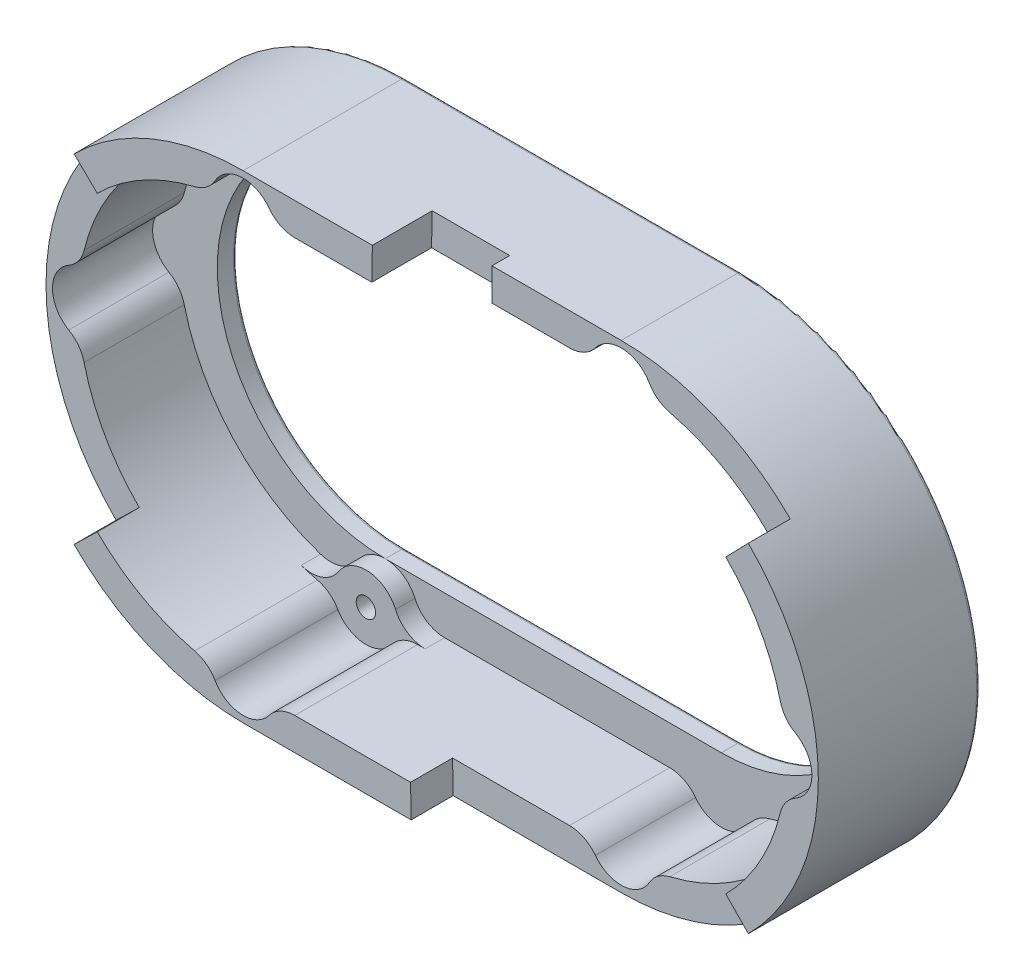
from build123d import *

# Parameters (mm, degrees)
BOSS_EXTRUDE1_DEPTH = 25
SKETCH1_3_R         = 1.5
BOSS_EXTRUDE2_DEPTH = 3
SKETCH2_W           = 12
SKETCH2_H           = 18.5
CUT_EXTRUDE1_DEPTH  = 5
BOSS_EXTRUDE3_START = 3
SKETCH1_4_R         = 5
SKETCH1_4_R_2       = 1.5
BOSS_EXTRUDE3_DEPTH = 3
FILLET2_R           = 5
FILLET3_R           = 5
FILLET1_R           = 0.5
CUT_EXTRUDE4_START  = -6.5
CUT_EXTRUDE4_DEPTH  = 6.5
CHAMFER1_START      = 18.5
CHAMFER1_DEPTH      = 6.5
CHAMFER1_START_2    = 15.75
CHAMFER1_2_DEPTH    = 2.75


with BuildPart() as part:
    # Sketch1 → Boss-Extrude1 (new body)
    with BuildSketch(Plane.XY):
        with BuildLine():
            Line((52, 37), (0, 37))
            ThreePointArc((0, 37), (-37, 0), (0, -37))
            Line((0, -37), (52, -37))
            ThreePointArc((52, -37), (89, 0), (52, 37))
        make_face()
        with BuildLine():
            ThreePointArc((-31.612903226, 4.96229278), (-22.627416998, 22.627416998), (-4.96229278, 31.612903226))
            ThreePointArc((-4.96229278, 31.612903226), (-0.196120171, 35.996152207), (4.898979486, 32))
            Line((4.898979486, 32), (47.101020514, 32))
            ThreePointArc((47.101020514, 32), (52.196120171, 35.996152207), (56.96229278, 31.612903226))
            ThreePointArc((56.96229278, 31.612903226), (74.627416998, 22.627416998), (83.612903226, 4.96229278))
            ThreePointArc((83.612903226, 4.96229278), (86.745965572, 3.311758134), (88, 0))
            ThreePointArc((88, 0), (86.745965572, -3.311758134), (83.612903226, -4.96229278))
            ThreePointArc((83.612903226, -4.96229278), (74.627416998, -22.627416998), (56.96229278, -31.612903226))
            ThreePointArc((56.96229278, -31.612903226), (52.196120171, -35.996152207), (47.101020514, -32))
            Line((47.101020514, -32), (4.898979486, -32))
            ThreePointArc((4.898979486, -32), (-0.196120171, -35.996152207), (-4.96229278, -31.612903226))
            ThreePointArc((-4.96229278, -31.612903226), (-22.627416998, -22.627416998), (-31.612903226, -4.96229278))
            ThreePointArc((-31.612903226, -4.96229278), (-36, 0), (-31.612903226, 4.96229278))
        make_face(mode=Mode.SUBTRACT)
    extrude(amount=BOSS_EXTRUDE1_DEPTH)

    # Sketch1<3> → Boss-Extrude2 (add)
    with BuildSketch(Plane.XY):
        with BuildLine():
            Line((4.898979486, -32), (47.101020514, -32))
            ThreePointArc((47.101020514, -32), (52.196120171, -35.996152207), (56.96229278, -31.612903226))
            ThreePointArc((56.96229278, -31.612903226), (74.627416998, -22.627416998), (83.612903226, -4.96229278))
            ThreePointArc((83.612903226, -4.96229278), (88, 0), (83.612903226, 4.96229278))
            ThreePointArc((83.612903226, 4.96229278), (74.627416998, 22.627416998), (56.96229278, 31.612903226))
            ThreePointArc((56.96229278, 31.612903226), (52.196120171, 35.996152207), (47.101020514, 32))
            Line((47.101020514, 32), (4.898979486, 32))
            ThreePointArc((4.898979486, 32), (-0.196120171, 35.996152207), (-4.96229278, 31.612903226))
            ThreePointArc((-4.96229278, 31.612903226), (-22.627416998, 22.627416998), (-31.612903226, 4.96229278))
            ThreePointArc((-31.612903226, 4.96229278), (-36, 0), (-31.612903226, -4.96229278))
            ThreePointArc((-31.612903226, -4.96229278), (-22.627416998, -22.627416998), (-4.96229278, -31.612903226))
            ThreePointArc((-4.96229278, -31.612903226), (-0.196120171, -35.996152207), (4.898979486, -32))
        make_face()
        with Locations((0, -31)):
            Circle(SKETCH1_3_R, mode=Mode.SUBTRACT)
        with Locations((83, 0)):
            Circle(SKETCH1_3_R, mode=Mode.SUBTRACT)
        with BuildLine():
            ThreePointArc((52, 26), (78, 0), (52, -26))
            Line((52, -26), (0, -26))
            ThreePointArc((0, -26), (-26, 0), (0, 26))
            Line((0, 26), (52, 26))
        make_face(mode=Mode.SUBTRACT)
        with Locations((0, 31)):
            Circle(SKETCH1_3_R, mode=Mode.SUBTRACT)
    extrude(amount=BOSS_EXTRUDE2_DEPTH)

    # Sketch2 → Cut-Extrude1 (cut)
    with BuildSketch(Plane(origin=(0, 37, 0), x_dir=(1, 0, 0), z_dir=(0, 1, 0))):
        with Locations((26, -25)):
            Rectangle(SKETCH2_W, SKETCH2_H)
    extrude(amount=-CUT_EXTRUDE1_DEPTH, mode=Mode.SUBTRACT)

    # Sketch1<4> → Boss-Extrude3 (add)
    # profile 1 of 3: a face of its own
    with BuildSketch(Plane.XY.offset(BOSS_EXTRUDE3_START)):
        with Locations((0, 31)):
            Circle(SKETCH1_4_R)
        with Locations((0, 31)):
            Circle(SKETCH1_4_R_2, mode=Mode.SUBTRACT)
    # profile 2 of 3: a face of its own
    with BuildSketch(Plane.XY.offset(BOSS_EXTRUDE3_START)):
        with Locations((83, 0)):
            Circle(SKETCH1_4_R)
        with Locations((83, 0)):
            Circle(SKETCH1_4_R_2, mode=Mode.SUBTRACT)
    # profile 3 of 3: a face of its own
    with BuildSketch(Plane.XY.offset(BOSS_EXTRUDE3_START)):
        with Locations((0, -31)):
            Circle(SKETCH1_4_R)
        with Locations((0, -31)):
            Circle(SKETCH1_4_R_2, mode=Mode.SUBTRACT)
    extrude(amount=BOSS_EXTRUDE3_DEPTH)

    # Fillet2
    # the kernel refuses this fillet: 5 mm, written as the material it adds along each edge
    with BuildSketch(Plane(origin=(83.612903226, 4.96229278, -9.980429616), x_dir=(-0.23470679108889272, 0.9720662128768569, 0), z_dir=(0, 0, 1))) as fillet2_piece_1_section:
        with BuildLine():
            CenterArc((4.786533421, 4.983518583), FILLET2_R, 198.802392553, 75.850995491)
            ThreePointArc((0.05335441, 3.371992458), (0.319549613, 1.681362163), (0, 0))
            ThreePointArc((0, 0), (2.596085923, -0.105481068), (5.192171846, 0))
        make_face()
    fillet2_piece_1 = extrude(amount=15.980429616, mode=Mode.PRIVATE)
    fillet2_piece_1 = split(fillet2_piece_1, bisect_by=Plane(origin=(83.612903226, 4.96229278, 0), z_dir=(0, 0, 1)), keep=Keep.TOP, mode=Mode.PRIVATE)
    add(fillet2_piece_1)
    with BuildSketch(Plane(origin=(83.612903226, -4.96229278, -9.980429616), x_dir=(-0.23470679108889236, -0.972066212876857, 0), z_dir=(0, 0, 1))) as fillet2_piece_2_section:
        with BuildLine():
            CenterArc((4.786533421, -4.983518583), FILLET2_R, 85.346611956, 75.850995491)
            ThreePointArc((0.05335441, -3.371992458), (0.319549613, -1.681362163), (0, 0))
            ThreePointArc((0, 0), (2.596085923, 0.105481068), (5.192171846, 0))
        make_face()
    fillet2_piece_2 = extrude(amount=15.980429616, mode=Mode.PRIVATE)
    fillet2_piece_2 = split(fillet2_piece_2, bisect_by=Plane(origin=(83.612903226, -4.96229278, 0), z_dir=(0, 0, 1)), keep=Keep.TOP, mode=Mode.PRIVATE)
    add(fillet2_piece_2)
    with BuildSketch(Plane(origin=(-4.96229278, 31.612903226, -9.980429616), x_dir=(-0.9720662128768562, -0.23470679108889492, 0), z_dir=(0, 0, 1))) as fillet2_piece_3_section:
        with BuildLine():
            CenterArc((4.786533421, 4.983518583), FILLET2_R, 198.802392553, 75.850995491)
            ThreePointArc((0.05335441, 3.371992458), (0.319549613, 1.681362163), (0, 0))
            ThreePointArc((0, 0), (2.596085923, -0.105481068), (5.192171846, 0))
        make_face()
    fillet2_piece_3 = extrude(amount=15.980429616, mode=Mode.PRIVATE)
    fillet2_piece_3 = split(fillet2_piece_3, bisect_by=Plane(origin=(-4.96229278, 31.612903226, 0), z_dir=(0, 0, 1)), keep=Keep.TOP, mode=Mode.PRIVATE)
    add(fillet2_piece_3)
    with BuildSketch(Plane(origin=(4.898979486, 32, -7.665429761), x_dir=(1, 0, 0), z_dir=(0, 0, 1))) as fillet2_piece_4_section:
        with BuildLine():
            CenterArc((4.266171904, -5), FILLET2_R, 90, 66.421821522)
            ThreePointArc((-0.316403791, -3), (0.073441671, -1.524430968), (0, 0))
            Line((0, 0), (4.266171904, 0))
        make_face()
    fillet2_piece_4 = extrude(amount=13.665429761, mode=Mode.PRIVATE)
    fillet2_piece_4 = split(fillet2_piece_4, bisect_by=Plane(origin=(4.898979486, 32, 0), z_dir=(0, 0, 1)), keep=Keep.TOP, mode=Mode.PRIVATE)
    add(fillet2_piece_4)
    with BuildSketch(Plane(origin=(-4.96229278, -31.612903226, -9.980429616), x_dir=(-0.9720662128768564, 0.23470679108889442, 0), z_dir=(0, 0, 1))) as fillet2_piece_5_section:
        with BuildLine():
            CenterArc((4.786533421, -4.983518583), FILLET2_R, 85.346611956, 75.850995491)
            ThreePointArc((0.05335441, -3.371992458), (0.319549613, -1.681362163), (0, 0))
            ThreePointArc((0, 0), (2.596085923, 0.105481068), (5.192171846, 0))
        make_face()
    fillet2_piece_5 = extrude(amount=15.980429616, mode=Mode.PRIVATE)
    fillet2_piece_5 = split(fillet2_piece_5, bisect_by=Plane(origin=(-4.96229278, -31.612903226, 0), z_dir=(0, 0, 1)), keep=Keep.TOP, mode=Mode.PRIVATE)
    add(fillet2_piece_5)
    with BuildSketch(Plane(origin=(4.898979486, -32, -7.665429761), x_dir=(1, 0, 0), z_dir=(0, 0, 1))) as fillet2_piece_6_section:
        with BuildLine():
            CenterArc((4.266171904, 5), FILLET2_R, 203.578178478, 66.421821522)
            ThreePointArc((-0.316403791, 3), (0.073441671, 1.524430968), (0, 0))
            Line((0, 0), (4.266171904, 0))
        make_face()
    fillet2_piece_6 = extrude(amount=13.665429761, mode=Mode.PRIVATE)
    fillet2_piece_6 = split(fillet2_piece_6, bisect_by=Plane(origin=(4.898979486, -32, 0), z_dir=(0, 0, 1)), keep=Keep.TOP, mode=Mode.PRIVATE)
    add(fillet2_piece_6)

    # Fillet3
    fillet3_edges = [part.edges().sort_by_distance(p)[0] for p in [
        (-4.96229278, 31.612903226, 15.5),
        (-31.612903226, 4.96229278, 14),
        (-31.612903226, -4.96229278, 14),
        (-4.96229278, -31.612903226, 15.5),
        (4.898979486, -32, 15.5),
        (47.101020514, -32, 14),
        (56.96229278, -31.612903226, 14),
        (83.612903226, -4.96229278, 15.5),
        (83.612903226, 4.96229278, 15.5),
        (56.96229278, 31.612903226, 14),
        (47.101020514, 32, 14),
        (4.898979486, 32, 15.5),
    ]]
    fillet(fillet3_edges, radius=FILLET3_R)

    # Fillet1
    fillet1_edges = [part.edges().sort_by_distance(p)[0] for p in [
        (-37, 0, 0),
        (26, 37, 0),
        (89, 0, 0),
        (26, -37, 0),
        (-1.5, 31, 0),
        (-1.5, -31, 0),
        (-26, 0, 0),
        (26, -26, 0),
        (78, 0, 0),
        (81.5, 0, 0),
        (26, 26, 0),
    ]]
    fillet(fillet1_edges, radius=FILLET1_R)

    # Sketch3 → Cut-Extrude4 (cut)
    with BuildSketch(Plane.XY.offset(25).offset(CUT_EXTRUDE4_START)):
        with BuildLine():
            ThreePointArc((-31.107236269, 7.505987725), (-27.910887593, 15.651912144), (-22.627416998, 22.627416998))
            Line((-22.627416998, 22.627416998), (-26.162950904, 26.162950904))
            ThreePointArc((-26.162950904, 26.162950904), (-37, 0), (-26.162950904, -26.162950904))
            Line((-26.162950904, -26.162950904), (-22.627416998, -22.627416998))
            ThreePointArc((-22.627416998, -22.627416998), (-27.910887593, -15.651912144), (-31.107236269, -7.505987725))
            ThreePointArc((-31.107236269, -7.505987725), (-31.968768588, -5.677429925), (-33.483870968, -4.339399154))
            ThreePointArc((-33.483870968, -4.339399154), (-36, 0), (-33.483870968, 4.339399154))
            ThreePointArc((-33.483870968, 4.339399154), (-31.968768588, 5.677429925), (-31.107236269, 7.505987725))
        make_face()
        with BuildLine():
            ThreePointArc((59.505987725, 31.107236269), (67.651912144, 27.910887593), (74.627416998, 22.627416998))
            Line((74.627416998, 22.627416998), (78.162950904, 26.162950904))
            ThreePointArc((78.162950904, 26.162950904), (66.159286998, 34.183542703), (52, 37))
            Line((52, 37), (32, 37))
            Line((32, 37), (32, 32))
            Line((32, 32), (44, 32))
            ThreePointArc((44, 32), (46.236067977, 32.527864045), (48, 34))
            ThreePointArc((48, 34), (52.3088612, 35.990451358), (56.339399154, 33.483870968))
            ThreePointArc((56.339399154, 33.483870968), (57.677429925, 31.968768588), (59.505987725, 31.107236269))
        make_face()
        with BuildLine():
            Line((44, -32), (26, -32))
            Line((26, -32), (26, -37))
            Line((26, -37), (52, -37))
            ThreePointArc((52, -37), (66.159286998, -34.183542703), (78.162950904, -26.162950904))
            Line((78.162950904, -26.162950904), (74.627416998, -22.627416998))
            ThreePointArc((74.627416998, -22.627416998), (67.651912144, -27.910887593), (59.505987725, -31.107236269))
            ThreePointArc((59.505987725, -31.107236269), (57.677429925, -31.968768588), (56.339399154, -33.483870968))
            ThreePointArc((56.339399154, -33.483870968), (52.3088612, -35.990451358), (48, -34))
            ThreePointArc((48, -34), (46.236067977, -32.527864045), (44, -32))
        make_face()
    extrude(amount=CUT_EXTRUDE4_DEPTH, mode=Mode.SUBTRACT)

    # Chamfer1: read off the stored shape, not the designer's step
    # Chamfer1 outline → Chamfer1 (cut)
    with BuildSketch(Plane.XY.offset(CHAMFER1_START)):
        with BuildLine():
            Line((74.682159055, 22.572542183), (78.164608978, 26.161292724))
            ThreePointArc((78.164608978, 26.161292724), (78.163779954, 26.162121827), (78.162950904, 26.162950904))
            Line((78.162950904, 26.162950904), (74.627416998, 22.627416998))
            ThreePointArc((74.627416998, 22.627416998), (74.654804641, 22.599996165), (74.682159055, 22.572542183))
        make_face()
        with BuildLine():
            ThreePointArc((78.162950904, -26.162950904), (78.163779954, -26.162121827), (78.164608978, -26.161292724))
            Line((78.164608978, -26.161292724), (74.682159055, -22.572542183))
            ThreePointArc((74.682159055, -22.572542183), (74.654804641, -22.599996165), (74.627416998, -22.627416998))
            Line((74.627416998, -22.627416998), (78.162950904, -26.162950904))
        make_face()
        Polygon((20, 32), (20, 37), (19.997275325, 37), (19.91, 32), align=None)
        Polygon((25.997275325, -37), (26, -37), (26, -32), (25.91, -32), align=None)
        with BuildLine():
            Line((-22.572542183, 22.682159055), (-26.161292724, 26.164608978))
            ThreePointArc((-26.161292724, 26.164608978), (-26.162121827, 26.163779954), (-26.162950904, 26.162950904))
            Line((-26.162950904, 26.162950904), (-22.627416998, 22.627416998))
            ThreePointArc((-22.627416998, 22.627416998), (-22.599996165, 22.654804641), (-22.572542183, 22.682159055))
        make_face()
        with BuildLine():
            ThreePointArc((-26.162950904, -26.162950904), (-26.162121827, -26.163779954), (-26.161292724, -26.164608978))
            Line((-26.161292724, -26.164608978), (-22.572542183, -22.682159055))
            ThreePointArc((-22.572542183, -22.682159055), (-22.599996165, -22.654804641), (-22.627416998, -22.627416998))
            Line((-22.627416998, -22.627416998), (-26.162950904, -26.162950904))
        make_face()
    extrude(amount=CHAMFER1_DEPTH, mode=Mode.SUBTRACT)

    # Chamfer1 2 outline → Chamfer1 2 (cut)
    with BuildSketch(Plane.XY.offset(CHAMFER1_START_2)):
        Polygon((20, 32), (20, 37), (19.997275325, 37), (19.91, 32), align=None)
    extrude(amount=CHAMFER1_2_DEPTH, mode=Mode.SUBTRACT)


solid = part.part
